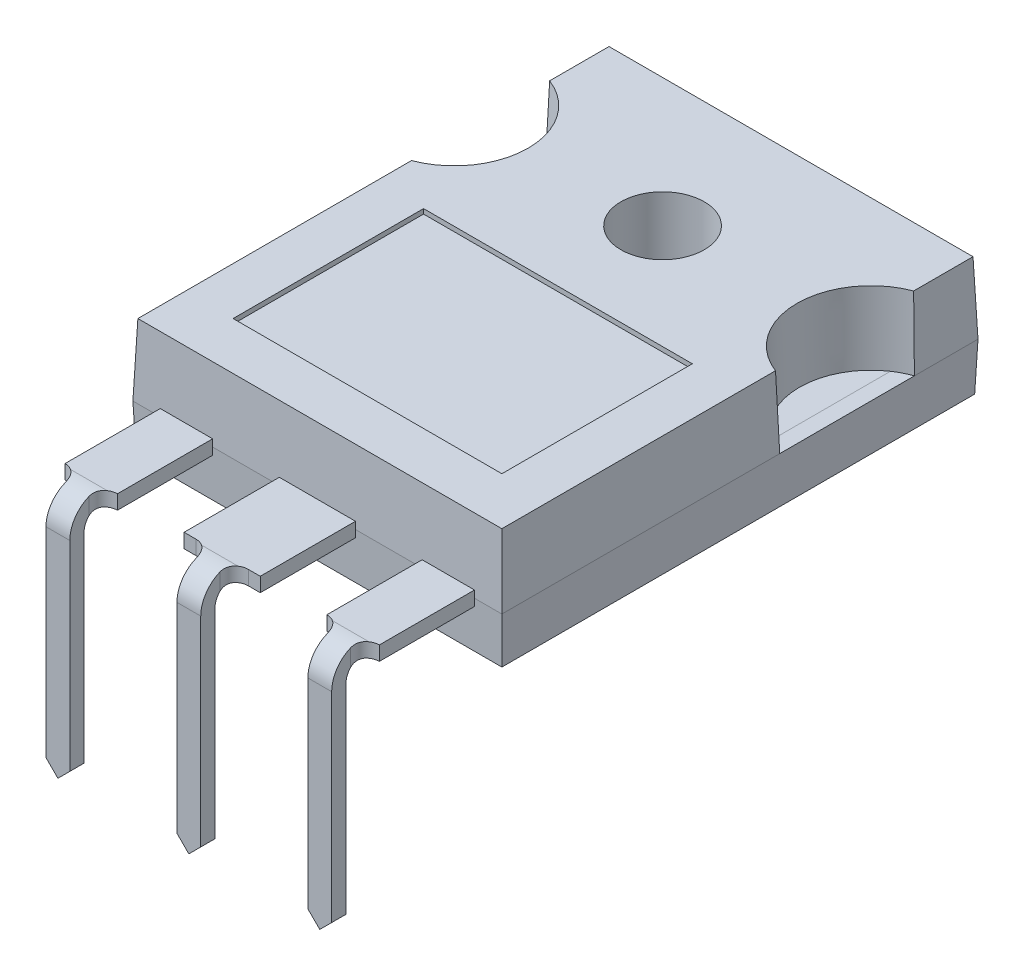
from build123d import *

# Parameters (mm, degrees)
SKETCH1_W             = 15.5
SKETCH1_H             = 20
EXTRUDE1_DEPTH        = 2
EXTRUDE1_DRAFT        = -2
EXTRUDE2_DEPTH        = 3
EXTRUDE2_TAPER        = 2
SKETCH3_R             = 1.75
EXTRUDE3_DEPTH        = 18.184658986
SKETCH4_W             = 2.2
SKETCH4_H             = 4
EXTRUDE4_DEPTH        = 0.3
SKETCH4_W_2           = 3.2
EXTRUDE4_2_DEPTH      = 0.3
EXTRUDE4_3_DEPTH      = 0.3
SKETCH5_W             = 11.290475384
SKETCH5_H             = 8
EXTRUDE5_DEPTH        = 0.2
SKETCH6_W             = 1
SKETCH6_H             = 0.6
CHAMFER1_SIZE         = 0.5
LPATTERN1_START       = 18.6
LPATTERN1_DEPTH       = 1.3
LPATTERN1_START_2     = 18.5
LPATTERN1_2_OUTLINE_W = 1
LPATTERN1_2_OUTLINE_H = 0.6
LPATTERN1_2_DEPTH     = 0.8
LPATTERN1_START_3     = 5
LPATTERN1_3_DEPTH     = 1
LPATTERN1_4_DEPTH     = 1.3
LPATTERN1_5_OUTLINE_W = 1
LPATTERN1_5_OUTLINE_H = 0.6
LPATTERN1_5_DEPTH     = 0.8
LPATTERN1_START_4     = -0.5
LPATTERN1_6_DEPTH     = 1
FILLET1_START         = -0.510102151
FILLET1_DEPTH         = 0.810102151
FILLET1_START_2       = -8
FILLET1_2_DEPTH       = 5
FILLET2_START         = -0.510102151
FILLET2_DEPTH         = 0.810102151
FILLET2_START_2       = -2
FILLET2_2_DEPTH       = 4
FILLET3_START         = -0.510102151
FILLET3_DEPTH         = 0.810102151
FILLET3_START_2       = 3
FILLET3_2_DEPTH       = 5
SKETCH7_R             = 3.25
CUT_EXTRUDE1_DEPTH    = 2
SKETCH8_R             = 3.25
EXTRUDE7_DEPTH        = 2


with BuildPart() as part:
    # Sketch1 → Extrude1 (with draft: the straight prism first)
    with BuildSketch(Plane(origin=(0, 0, 0), x_dir=(1, 0, 0), z_dir=(0, 1, 0))):
        with Locations((0, -4.5)):
            Rectangle(SKETCH1_W, SKETCH1_H)
    extrude(amount=-EXTRUDE1_DEPTH)
    # Extrude1: the draft: its side faces are tilted about the plane it starts from
    extrude1_sides = [part.faces().sort_by_distance(p)[0] for p in [
        (7.75, -1, 4.5),
        (0, -1, -5.5),
        (-7.75, -1, 4.5),
        (0, -1, 14.5),
    ]]
    draft(extrude1_sides, Plane(origin=(0, 0, 0), x_dir=(1, 0, 0), z_dir=(0, 1, 0)), EXTRUDE1_DRAFT)

    # Sketch2 → Extrude2 (add)
    with BuildSketch(Plane(origin=(0, 0, 0), x_dir=(1, 0, 0), z_dir=(0, 1, 0))):
        with BuildLine():
            Line((-7.75, -2.828427125), (-7.75, -14.5))
            Line((-7.75, -14.5), (7.75, -14.5))
            Line((7.75, -14.5), (7.75, -2.828427125))
            ThreePointArc((7.75, -2.828427125), (5.75, 0), (7.75, 2.828427125))
            Line((7.75, 2.828427125), (7.75, 5.5))
            Line((7.75, 5.5), (-7.75, 5.5))
            Line((-7.75, 5.5), (-7.75, 2.828427125))
            ThreePointArc((-7.75, 2.828427125), (-5.75, 0), (-7.75, -2.828427125))
        make_face()
    extrude(amount=EXTRUDE2_DEPTH, taper=EXTRUDE2_TAPER)

    # Sketch3 → Extrude3 (cut, through all)
    with BuildSketch(Plane(origin=(0, 3, 0), x_dir=(1, 0, 0), z_dir=(0, 1, 0))):
        with Locations(Location((0, 0, 0), (0, 0, 270))):
            Circle(SKETCH3_R)
    extrude(amount=-EXTRUDE3_DEPTH, mode=Mode.SUBTRACT)

    # Sketch5 → Extrude5 (cut)
    with BuildSketch(Plane(origin=(0, 3, 0), x_dir=(1, 0, 0), z_dir=(0, 1, 0))):
        with Locations((0, -8.395237692)):
            Rectangle(SKETCH5_W, SKETCH5_H)
    extrude(amount=-EXTRUDE5_DEPTH, mode=Mode.SUBTRACT)

    # Sketch7 → Cut-Extrude1 (cut)
    with BuildSketch(Plane.XZ.offset(2)):
        with BuildLine():
            Line((-7.080158461, 12.830158461), (-7.080158461, -3.830158461))
            ThreePointArc((-7.080158461, -3.830158461), (-6.787265242, -4.537265242), (-6.080158461, -4.830158461))
            Line((-6.080158461, -4.830158461), (6.080158461, -4.830158461))
            ThreePointArc((6.080158461, -4.830158461), (6.787265242, -4.537265242), (7.080158461, -3.830158461))
            Line((7.080158461, -3.830158461), (7.080158461, 12.830158461))
            ThreePointArc((7.080158461, 12.830158461), (6.787265242, 13.537265242), (6.080158461, 13.830158461))
            Line((6.080158461, 13.830158461), (-6.080158461, 13.830158461))
            ThreePointArc((-6.080158461, 13.830158461), (-6.787265242, 13.537265242), (-7.080158461, 12.830158461))
        make_face()
        with Locations(Location((0, 0, 0), (0, 0, 270))):
            Circle(SKETCH7_R, mode=Mode.SUBTRACT)
    extrude(amount=-CUT_EXTRUDE1_DEPTH, mode=Mode.SUBTRACT)


with BuildPart() as body_2:
    # Sketch4 → Extrude4 (new, symmetric)
    with BuildSketch(Plane(origin=(0, 0, 0), x_dir=(1, 0, 0), z_dir=(0, 1, 0))):
        with Locations((-5.5, -16.5)):
            Rectangle(SKETCH4_W, SKETCH4_H)
    extrude(amount=EXTRUDE4_DEPTH, both=True)

    # Sweep1: sweep along a curve in space
    with BuildLine() as sweep1_path:
        Line((-5.5, 0, 18.5), (-5.5, 0, 18.6))
        ThreePointArc((-5.5, -1, 19.6), (-5.5, -0.292893219, 19.307106781), (-5.5, 0, 18.6))
        Line((-5.5, -9.9, 19.6), (-5.5, -1, 19.6))
    # Sketch6 → Sweep1 (sweep)
    with BuildSketch(Plane.XY.offset(18.5)):
        with Locations((-5.5, 0)):
            Rectangle(SKETCH6_W, SKETCH6_H)
    sweep(path=sweep1_path.line)

    # Chamfer1
    chamfer1_edges = [body_2.edges().sort_by_distance(p)[0] for p in [
        (-6, -9.9, 19.6),
        (-5, -9.9, 19.6),
    ]]
    chamfer(chamfer1_edges, length=CHAMFER1_SIZE - 0.0001)  # a hair under: the kernel refuses the full size

    # Fillet1: read off the stored shape, not the designer's step
    # Fillet1 outline → Fillet1 (add)
    with BuildSketch(Plane(origin=(0, 0, 0), x_dir=(1, 0, 0), z_dir=(0, 1, 0)).offset(FILLET1_START)):
        with BuildLine():
            Line((-5, -18.5), (-5, -19.1))
            ThreePointArc((-5, -19.1), (-4.824264069, -18.675735931), (-4.4, -18.5))
            Line((-4.4, -18.5), (-5, -18.5))
        make_face()
        with BuildLine():
            ThreePointArc((-6.6, -18.5), (-6.175735931, -18.675735931), (-6, -19.1))
            Line((-6, -19.1), (-6, -18.5))
            Line((-6, -18.5), (-6.6, -18.5))
        make_face()
    extrude(amount=FILLET1_DEPTH)

    # Fillet1 2 outline → Fillet1 2 (cut)
    with BuildSketch(Plane.YZ.offset(FILLET1_START_2)):
        with BuildLine():
            Line((-0.510102102, 19.10000005), (-0.510102151, 18.5))
            Line((-0.510102151, 18.5), (-0.3, 18.5))
            Line((-0.3, 18.5), (-0.3, 18.6))
            ThreePointArc((-0.3, 18.6), (-0.354659575, 18.871174733), (-0.510102102, 19.10000005))
        make_face()
        with BuildLine():
            Line((0.3, 19.1), (0.2, 19.1))
            ThreePointArc((0.2, 19.1), (0.274754878, 18.854950976), (0.3, 18.6))
            Line((0.3, 18.6), (0.3, 19.1))
        make_face()
    extrude(amount=FILLET1_2_DEPTH, mode=Mode.SUBTRACT)


with BuildPart() as body_3:
    # Sketch4 → Extrude4 2 (new, symmetric)
    with BuildSketch(Plane(origin=(0, 0, 0), x_dir=(1, 0, 0), z_dir=(0, 1, 0))):
        with Locations((0, -16.5)):
            Rectangle(SKETCH4_W_2, SKETCH4_H)
    extrude(amount=EXTRUDE4_2_DEPTH, both=True)

    # LPattern1 4 outline → LPattern1 4 (add)
    with BuildSketch(Plane.XY.offset(LPATTERN1_START)):
        Polygon((-0.5, -9.4), (0, -9.9), (0.5, -9.4), (0.5, 0.3), (-0.5, 0.3), align=None)
    extrude(amount=LPATTERN1_4_DEPTH)

    # LPattern1 5 outline → LPattern1 5 (add)
    with BuildSketch(Plane.XY.offset(LPATTERN1_START_2)):
        Rectangle(LPATTERN1_5_OUTLINE_W, LPATTERN1_5_OUTLINE_H)
    extrude(amount=LPATTERN1_5_DEPTH)

    # LPattern1 6 outline → LPattern1 6 (cut)
    with BuildSketch(Plane.YZ.offset(LPATTERN1_START_4)):
        with BuildLine():
            Line((-1, 19.3), (-11, 19.3))
            Line((-11, 19.3), (-11, 18.6))
            Line((-11, 18.6), (-0.3, 18.6))
            ThreePointArc((-0.3, 18.6), (-0.505025253, 19.094974747), (-1, 19.3))
        make_face()
        with BuildLine():
            Line((0.3, 19.9), (-1, 19.9))
            ThreePointArc((-1, 19.9), (-0.080761184, 19.519238816), (0.3, 18.6))
            Line((0.3, 18.6), (0.3, 19.9))
        make_face()
    extrude(amount=LPATTERN1_6_DEPTH, mode=Mode.SUBTRACT)

    # Fillet2: read off the stored shape, not the designer's step
    # Fillet2 outline → Fillet2 (add)
    with BuildSketch(Plane(origin=(0, 0, 0), x_dir=(1, 0, 0), z_dir=(0, 1, 0)).offset(FILLET2_START)):
        with BuildLine():
            ThreePointArc((-1.1, -18.5), (-0.675735931, -18.675735931), (-0.5, -19.1))
            Line((-0.5, -19.1), (-0.5, -18.5))
            Line((-0.5, -18.5), (-1.1, -18.5))
        make_face()
        with BuildLine():
            Line((0.5, -18.5), (0.5, -19.1))
            ThreePointArc((0.5, -19.1), (0.675735931, -18.675735931), (1.1, -18.5))
            Line((1.1, -18.5), (0.5, -18.5))
        make_face()
    extrude(amount=FILLET2_DEPTH)

    # Fillet2 2 outline → Fillet2 2 (cut)
    with BuildSketch(Plane.YZ.offset(FILLET2_START_2)):
        with BuildLine():
            Line((-0.510102102, 19.10000005), (-0.510102151, 18.5))
            Line((-0.510102151, 18.5), (-0.3, 18.5))
            Line((-0.3, 18.5), (-0.3, 18.6))
            ThreePointArc((-0.3, 18.6), (-0.354659575, 18.871174733), (-0.510102102, 19.10000005))
        make_face()
        with BuildLine():
            Line((0.3, 19.1), (0.2, 19.1))
            ThreePointArc((0.2, 19.1), (0.274754878, 18.854950976), (0.3, 18.6))
            Line((0.3, 18.6), (0.3, 19.1))
        make_face()
    extrude(amount=FILLET2_2_DEPTH, mode=Mode.SUBTRACT)


with BuildPart() as body_4:
    # Sketch4 → Extrude4 3 (new, symmetric)
    with BuildSketch(Plane(origin=(0, 0, 0), x_dir=(1, 0, 0), z_dir=(0, 1, 0))):
        with Locations((5.5, -16.5)):
            Rectangle(SKETCH4_W, SKETCH4_H)
    extrude(amount=EXTRUDE4_3_DEPTH, both=True)

    # LPattern1: read off the stored shape, not the designer's step
    # LPattern1 outline → LPattern1 (add)
    with BuildSketch(Plane.XY.offset(LPATTERN1_START)):
        Polygon((5, -9.4), (5.5, -9.9), (6, -9.4), (6, 0.3), (5, 0.3), align=None)
    extrude(amount=LPATTERN1_DEPTH)

    # LPattern1 2 outline → LPattern1 2 (add)
    with BuildSketch(Plane.XY.offset(LPATTERN1_START_2)):
        with Locations((5.5, 0)):
            Rectangle(LPATTERN1_2_OUTLINE_W, LPATTERN1_2_OUTLINE_H)
    extrude(amount=LPATTERN1_2_DEPTH)

    # LPattern1 3 outline → LPattern1 3 (cut)
    with BuildSketch(Plane.YZ.offset(LPATTERN1_START_3)):
        with BuildLine():
            Line((-1, 19.3), (-11, 19.3))
            Line((-11, 19.3), (-11, 18.6))
            Line((-11, 18.6), (-0.3, 18.6))
            ThreePointArc((-0.3, 18.6), (-0.505025253, 19.094974747), (-1, 19.3))
        make_face()
        with BuildLine():
            Line((0.3, 19.9), (-1, 19.9))
            ThreePointArc((-1, 19.9), (-0.080761184, 19.519238816), (0.3, 18.6))
            Line((0.3, 18.6), (0.3, 19.9))
        make_face()
    extrude(amount=LPATTERN1_3_DEPTH, mode=Mode.SUBTRACT)

    # Fillet3: read off the stored shape, not the designer's step
    # Fillet3 outline → Fillet3 (add)
    with BuildSketch(Plane(origin=(0, 0, 0), x_dir=(1, 0, 0), z_dir=(0, 1, 0)).offset(FILLET3_START)):
        with BuildLine():
            ThreePointArc((4.4, -18.5), (4.824264069, -18.675735931), (5, -19.1))
            Line((5, -19.1), (5, -18.5))
            Line((5, -18.5), (4.4, -18.5))
        make_face()
        with BuildLine():
            Line((6, -18.5), (6, -19.1))
            ThreePointArc((6, -19.1), (6.175735931, -18.675735931), (6.6, -18.5))
            Line((6.6, -18.5), (6, -18.5))
        make_face()
    extrude(amount=FILLET3_DEPTH)

    # Fillet3 2 outline → Fillet3 2 (cut)
    with BuildSketch(Plane.YZ.offset(FILLET3_START_2)):
        with BuildLine():
            Line((-0.510102102, 19.10000005), (-0.510102151, 18.5))
            Line((-0.510102151, 18.5), (-0.3, 18.5))
            Line((-0.3, 18.5), (-0.3, 18.6))
            ThreePointArc((-0.3, 18.6), (-0.354659575, 18.871174733), (-0.510102102, 19.10000005))
        make_face()
        with BuildLine():
            Line((0.3, 19.1), (0.2, 19.1))
            ThreePointArc((0.2, 19.1), (0.274754878, 18.854950976), (0.3, 18.6))
            Line((0.3, 18.6), (0.3, 19.1))
        make_face()
    extrude(amount=FILLET3_2_DEPTH, mode=Mode.SUBTRACT)


with BuildPart() as body_5:
    # Sketch8 → Extrude7 (new body)
    with BuildSketch(Plane.XZ.offset(2)):
        with BuildLine():
            Line((-7.080158461, 12.830158461), (-7.080158461, -3.830158461))
            ThreePointArc((-7.080158461, -3.830158461), (-6.787265242, -4.537265242), (-6.080158461, -4.830158461))
            Line((-6.080158461, -4.830158461), (6.080158461, -4.830158461))
            ThreePointArc((6.080158461, -4.830158461), (6.787265242, -4.537265242), (7.080158461, -3.830158461))
            Line((7.080158461, -3.830158461), (7.080158461, 12.830158461))
            ThreePointArc((7.080158461, 12.830158461), (6.787265242, 13.537265242), (6.080158461, 13.830158461))
            Line((6.080158461, 13.830158461), (-6.080158461, 13.830158461))
            ThreePointArc((-6.080158461, 13.830158461), (-6.787265242, 13.537265242), (-7.080158461, 12.830158461))
        make_face()
        with Locations(Location((0, 0, 0), (0, 0, 270))):
            Circle(SKETCH8_R, mode=Mode.SUBTRACT)
    extrude(amount=-EXTRUDE7_DEPTH)


solid = Compound([part.part, body_2.part, body_3.part, body_4.part, body_5.part])
